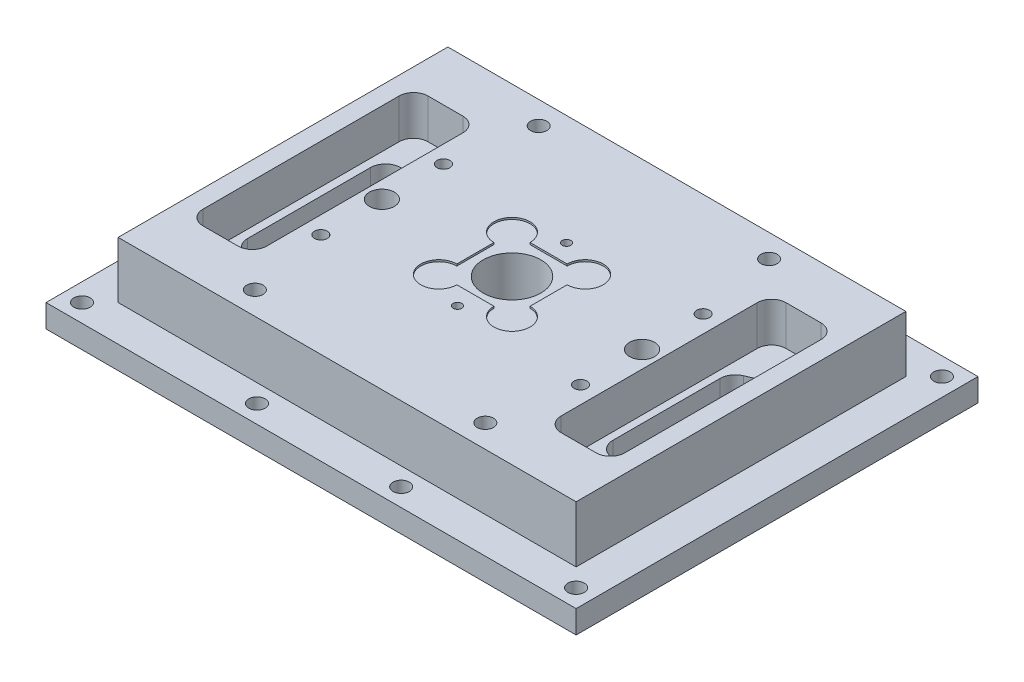
from build123d import *

# Parameters (mm, degrees)
MAIN_SKETCH_W                           = 73.5
MAIN_SKETCH_H                           = 55.72
MAIN_SKETCH_W_2                         = 63.5
MAIN_SKETCH_H_2                         = 45.72
LIP_DEPTH                               = 3.175
MOUNTING_BASE_OUTLINE_W                 = 63.5
MOUNTING_BASE_OUTLINE_H                 = 45.72
MOUNTING_BASE_OUTLINE_R                 = 1.7272
MOUNTING_BASE_OUTLINE_R_2               = 4
MOUNTING_BASE_DEPTH                     = 11
HEATER_CART_4_40_TAPS_D                 = 2.2606
HEATER_CART_4_40_TAPS_DEPTH             = 7.595
HEATER_CART_4_40_TAPS_TIP               = 0.679152758
MAIN_SKETCH_12_W                        = 8.85
MAIN_SKETCH_12_H                        = 31.2
BOTTOM_SQUARE_CUTOUT_DEPTH              = 2
SQUARE_MICRO_D_CUTOUT_START             = 5.5
SQUARE_MICRO_D_CUTOUT_OUTLINE_W         = 8.85
SQUARE_MICRO_D_CUTOUT_OUTLINE_H         = 31.2
SQUARE_MICRO_D_CUTOUT_DEPTH             = 5.5
ROUND_MICRO_D_CUTOUT_REACH              = 94.887
MAIN_SKETCH_7_R                         = 0.285
INTERNAL_CORNER_CUTOUTS_FILLET_R        = 2
CHIP_CLAMP_0_80_TAPS_AT_2_COUNT         = 2
CHIP_CLAMP_0_80_TAPS_AT_2_PITCH         = 15.1232
CHIP_CLAMP_0_80_TAPS_AT_3_COUNT         = 2
CHIP_CLAMP_0_80_TAPS_AT_3_PITCH         = 15.1232
CHIP_POCKET_START                       = 10.75
MAIN_SKETCH_6_R                         = 2.5
MAIN_SKETCH_6_W                         = 10.15
MAIN_SKETCH_6_H                         = 10.15
CHIP_POCKET_DEPTH                       = 0.25
F_2_56_CLOSE_CLEAR_43_0_089_D           = 2.2606
F_2_56_CLOSE_CLEAR_43_0_089_ON_FACE_2_D = 2.2606
F_2_56_CLOSE_CLEAR_43_0_089_ON_FACE_3_D = 2.2606
PCB_2_56_TAPS_D                         = 1.778
PCB_2_56_TAPS_DEPTH                     = 5.734
PCB_2_56_TAPS_TIP                       = 0.53416509
BOTTOM_COVER_2_56_TAPS_D                = 1.778
BOTTOM_COVER_2_56_TAPS_DEPTH            = 5.734
BOTTOM_COVER_2_56_TAPS_TIP              = 0.53416509


# Read off the part's stored shape, not the designer's step: Mounting_Base, Square_Micro_D_Cutout
with BuildPart() as part:
    # Main_Sketch → Lip (new body)
    with BuildSketch(Plane(origin=(0, 0, 0), x_dir=(1, 0, 0), z_dir=(0, 1, 0))):
        with Locations((36.75, -27.86)):
            Rectangle(MAIN_SKETCH_W, MAIN_SKETCH_H)
        with Locations((36.75, -27.86)):
            Rectangle(MAIN_SKETCH_W_2, MAIN_SKETCH_H_2, mode=Mode.SUBTRACT)
    extrude(amount=LIP_DEPTH)

    # Mounting_Base outline → Mounting_Base (add)
    with BuildSketch(Plane(origin=(0, 0, 0), x_dir=(1, 0, 0), z_dir=(0, 1, 0))):
        with Locations((36.75, -27.86)):
            Rectangle(MOUNTING_BASE_OUTLINE_W, MOUNTING_BASE_OUTLINE_H)
        with Locations((18.715, -27.86)):
            Circle(MOUNTING_BASE_OUTLINE_R, mode=Mode.SUBTRACT)
        with Locations((36.75, -27.86)):
            Circle(MOUNTING_BASE_OUTLINE_R_2, mode=Mode.SUBTRACT)
        with Locations((54.785, -27.86)):
            Circle(MOUNTING_BASE_OUTLINE_R, mode=Mode.SUBTRACT)
    extrude(amount=MOUNTING_BASE_DEPTH)

    # Heater_Cart_#4-40_Taps
    with Locations(Plane(origin=(20.775, 11, 8.185), x_dir=(0, 0, 1), z_dir=(0, 1, 0))):
        with Locations((0, 0), (0, 31.95), (39.35, 31.95), (39.35, 0)):
            Hole(HEATER_CART_4_40_TAPS_D / 2, depth=HEATER_CART_4_40_TAPS_DEPTH)
            with Locations((0, 0, -(HEATER_CART_4_40_TAPS_DEPTH + HEATER_CART_4_40_TAPS_TIP / 2))):  # 118° drill point
                Cone(0, HEATER_CART_4_40_TAPS_D / 2, HEATER_CART_4_40_TAPS_TIP, mode=Mode.SUBTRACT)

    # Main_Sketch<12> → Bottom_square_cutout (cut)
    with BuildSketch(Plane(origin=(0, 0, 0), x_dir=(1, 0, 0), z_dir=(0, 1, 0))):
        with Locations((11.925, -27.86)):
            Rectangle(MAIN_SKETCH_12_W, MAIN_SKETCH_12_H)
        with BuildLine():
            ThreePointArc((11.521574965, -38.306222286), (10.496212222, -38.461578951), (9.521946869, -38.106175702))
            ThreePointArc((9.521946869, -38.106175702), (8.851632057, -37.354424217), (8.609546604, -36.37675))
            Line((8.609546604, -36.37675), (8.609546604, -19.34325))
            ThreePointArc((8.609546604, -19.34325), (8.851632057, -18.365575783), (9.521946869, -17.613824298))
            ThreePointArc((9.521946869, -17.613824298), (10.496212222, -17.258421049), (11.521574965, -17.413777714))
            Line((11.521574965, -17.413777714), (14.054010046, -18.48581902))
            ThreePointArc((14.054010046, -18.48581902), (14.983840891, -19.258001292), (15.3324534, -20.415291306))
            Line((15.3324534, -20.415291306), (15.3324534, -35.304708694))
            ThreePointArc((15.3324534, -35.304708694), (14.983840891, -36.461998708), (14.054010046, -37.23418098))
            Line((14.054010046, -37.23418098), (11.521574965, -38.306222286))
        make_face(mode=Mode.SUBTRACT)
    bottom_square_cutout = extrude(amount=BOTTOM_SQUARE_CUTOUT_DEPTH, mode=Mode.SUBTRACT)

    # Square_Micro_D_Cutout outline → Square_Micro_D_Cutout (cut)
    with BuildSketch(Plane(origin=(0, 0, 0), x_dir=(1, 0, 0), z_dir=(0, 1, 0)).offset(SQUARE_MICRO_D_CUTOUT_START)):
        with Locations((11.925, -27.86)):
            Rectangle(SQUARE_MICRO_D_CUTOUT_OUTLINE_W, SQUARE_MICRO_D_CUTOUT_OUTLINE_H)
        with BuildLine():
            ThreePointArc((11.521574965, -38.306222286), (9.547492447, -38.123373348), (8.609546604, -36.37675))
            Line((8.609546604, -36.37675), (8.609546604, -19.34325))
            ThreePointArc((8.609546604, -19.34325), (9.547492447, -17.596626652), (11.521574965, -17.413777714))
            Line((11.521574965, -17.413777714), (14.054010046, -18.48581902))
            ThreePointArc((14.054010046, -18.48581902), (14.983840891, -19.258001291), (15.3324534, -20.415291306))
            Line((15.3324534, -20.415291306), (15.3324534, -35.304708694))
            ThreePointArc((15.3324534, -35.304708694), (14.983840891, -36.461998709), (14.054010046, -37.23418098))
            Line((14.054010046, -37.23418098), (11.521574965, -38.306222286))
        make_face(mode=Mode.SUBTRACT)
    square_micro_d_cutout = extrude(amount=SQUARE_MICRO_D_CUTOUT_DEPTH, mode=Mode.SUBTRACT)

    # Main_Sketch<7> → Round_Micro_D_Cutout (cut, up to next)
    with BuildSketch(Plane(origin=(0, 0, 0), x_dir=(1, 0, 0), z_dir=(0, 1, 0)), mode=Mode.PRIVATE) as round_micro_d_cutout_sk1:
        with BuildLine():
            ThreePointArc((9.521946869, -38.106175702), (8.851632057, -37.354424217), (8.609546604, -36.37675))
            Line((8.609546604, -36.37675), (8.609546604, -19.34325))
            ThreePointArc((8.609546604, -19.34325), (8.851632057, -18.365575783), (9.521946869, -17.613824298))
            ThreePointArc((9.521946869, -17.613824298), (10.496212222, -17.258421049), (11.521574965, -17.413777714))
            Line((11.521574965, -17.413777714), (14.054010046, -18.48581902))
            ThreePointArc((14.054010046, -18.48581902), (14.983840891, -19.258001292), (15.3324534, -20.415291306))
            Line((15.3324534, -20.415291306), (15.3324534, -35.304708694))
            ThreePointArc((15.3324534, -35.304708694), (14.983840891, -36.461998708), (14.054010046, -37.23418098))
            Line((14.054010046, -37.23418098), (11.521574965, -38.306222286))
            ThreePointArc((11.521574965, -38.306222286), (10.496212222, -38.461578951), (9.521946869, -38.106175702))
        make_face()
        with Locations((11.399546604, -27.86)):
            Circle(MAIN_SKETCH_7_R, mode=Mode.SUBTRACT)
    round_micro_d_cutout_tool1 = extrude(round_micro_d_cutout_sk1.sketch, amount=ROUND_MICRO_D_CUTOUT_REACH, mode=Mode.PRIVATE) & part.part
    # Main_Sketch<7> → Round_Micro_D_Cutout (cut, up to next)
    with BuildSketch(Plane(origin=(0, 0, 0), x_dir=(1, 0, 0), z_dir=(0, 1, 0)), mode=Mode.PRIVATE) as round_micro_d_cutout_sk2:
        with Locations((11.399546604, -27.86)):
            Circle(MAIN_SKETCH_7_R)
    round_micro_d_cutout_tool2 = extrude(round_micro_d_cutout_sk2.sketch, amount=ROUND_MICRO_D_CUTOUT_REACH, mode=Mode.PRIVATE) & part.part
    round_micro_d_cutout_1 = round_micro_d_cutout_tool1.solids().sort_by_distance((11.886838, 0, 27.86))[0]
    add(round_micro_d_cutout_1, mode=Mode.SUBTRACT)
    round_micro_d_cutout_2 = round_micro_d_cutout_tool2.solids().sort_by_distance((11.399547, 0, 27.86))[0]
    add(round_micro_d_cutout_2, mode=Mode.SUBTRACT)
    round_micro_d_cutout = round_micro_d_cutout_1 + round_micro_d_cutout_2  # Round_Micro_D_Cutout as one shape, for the pattern or mirror that repeats it

    # MicroD_Mirror: Bottom_square_cutout, Square_Micro_D_Cutout, Round_Micro_D_Cutout across plane
    add(bottom_square_cutout.mirror(Plane.ZY.offset(-36.75)), mode=Mode.SUBTRACT)
    add(square_micro_d_cutout.mirror(Plane.ZY.offset(-36.75)), mode=Mode.SUBTRACT)
    add(round_micro_d_cutout.mirror(Plane.ZY.offset(-36.75)), mode=Mode.SUBTRACT)

    # Internal_Corner_cutouts_fillet
    internal_corner_cutouts_fillet_edges = [part.edges().sort_by_distance(p)[0] for p in [
        (16.35, 8.25, 43.46),
        (7.5, 8.25, 43.46),
        (7.5, 8.25, 12.26),
        (16.35, 8.25, 12.26),
        (57.15, 1, 12.26),
        (57.15, 1, 43.46),
        (66, 1, 43.46),
        (66, 1, 12.26),
        (66, 8.25, 12.26),
        (66, 8.25, 43.46),
        (57.15, 8.25, 43.46),
        (57.15, 8.25, 12.26),
        (16.35, 1, 43.46),
        (16.35, 1, 12.26),
        (7.5, 1, 12.26),
        (7.5, 1, 43.46),
    ]]
    fillet(internal_corner_cutouts_fillet_edges, radius=INTERNAL_CORNER_CUTOUTS_FILLET_R)

    # Sketch3 → Chip_Clamp_#0-80 Taps (revolve, cut)
    with BuildSketch(Plane(origin=(36.75, 11, 35.4216), x_dir=(0, 0, 1), z_dir=(1, 0, 0))):
        Polygon((0, 0), (0, 4.358890611), (0.59563, 4.001), (0.59563, 0), align=None)
    chip_clamp_0_80_taps = revolve(axis=Axis((36.75, 17.35, 35.4216), (0, -1, 0)), mode=Mode.SUBTRACT)

    # Chip_Clamp_#0-80 Taps at 2: Chip_Clamp_#0-80 Taps ×2
    with Locations(*[(0, 0, -i * CHIP_CLAMP_0_80_TAPS_AT_2_PITCH) for i in range(1, CHIP_CLAMP_0_80_TAPS_AT_2_COUNT)]):
        add(chip_clamp_0_80_taps, mode=Mode.SUBTRACT)

    # Chip_Clamp_#0-80 Taps at 3: Chip_Clamp_#0-80 Taps ×2
    with Locations(*[(0, 0, -i * CHIP_CLAMP_0_80_TAPS_AT_3_PITCH) for i in range(1, CHIP_CLAMP_0_80_TAPS_AT_3_COUNT)]):
        add(chip_clamp_0_80_taps, mode=Mode.SUBTRACT)

    # Main_Sketch<6> → Chip_Pocket (cut)
    with BuildSketch(Plane(origin=(0, 0, 0), x_dir=(1, 0, 0), z_dir=(0, 1, 0)).offset(CHIP_POCKET_START)):
        with BuildLine():
            Line((31.675, -25.285), (31.675, -22.785))
            Line((31.675, -22.785), (34.175, -22.785))
            ThreePointArc((34.175, -22.785), (29.907233047, -21.017233047), (31.675, -25.285))
        make_face()
        with BuildLine():
            Line((34.175, -22.785), (31.675, -22.785))
            Line((31.675, -22.785), (31.675, -25.285))
            ThreePointArc((31.675, -25.285), (33.442766953, -24.552766953), (34.175, -22.785))
        make_face()
        with BuildLine():
            ThreePointArc((44.325, -22.785), (41.825, -20.285), (39.325, -22.785))
            Line((39.325, -22.785), (41.825, -22.785))
            Line((41.825, -22.785), (41.825, -25.285))
            ThreePointArc((41.825, -25.285), (43.592766953, -24.552766953), (44.325, -22.785))
        make_face()
        with BuildLine():
            Line((41.825, -22.785), (39.325, -22.785))
            ThreePointArc((39.325, -22.785), (40.057233047, -24.552766953), (41.825, -25.285))
            Line((41.825, -25.285), (41.825, -22.785))
        make_face()
        with BuildLine():
            ThreePointArc((34.175, -32.935), (33.442766953, -31.167233047), (31.675, -30.435))
            Line((31.675, -30.435), (31.675, -32.935))
            Line((31.675, -32.935), (34.175, -32.935))
        make_face()
        with BuildLine():
            Line((31.675, -32.935), (31.675, -30.435))
            ThreePointArc((31.675, -30.435), (29.907233047, -34.702766953), (34.175, -32.935))
            Line((34.175, -32.935), (31.675, -32.935))
        make_face()
        with BuildLine():
            ThreePointArc((44.325, -32.935), (43.592766953, -31.167233047), (41.825, -30.435))
            Line((41.825, -30.435), (41.825, -32.935))
            Line((41.825, -32.935), (39.325, -32.935))
            ThreePointArc((39.325, -32.935), (41.825, -35.435), (44.325, -32.935))
        make_face()
        with BuildLine():
            Line((41.825, -32.935), (41.825, -30.435))
            ThreePointArc((41.825, -30.435), (40.057233047, -31.167233047), (39.325, -32.935))
            Line((39.325, -32.935), (41.825, -32.935))
        make_face()
        with Locations((41.825, -32.935)):
            Circle(MAIN_SKETCH_6_R)
        with Locations((41.825, -22.785)):
            Circle(MAIN_SKETCH_6_R)
        with Locations((31.675, -22.785)):
            Circle(MAIN_SKETCH_6_R)
        with Locations((31.675, -32.935)):
            Circle(MAIN_SKETCH_6_R)
        with Locations((36.75, -27.86)):
            Rectangle(MAIN_SKETCH_6_W, MAIN_SKETCH_6_H)
    extrude(amount=CHIP_POCKET_DEPTH, mode=Mode.SUBTRACT)

    # 2-56_Close_Clear#43 (0.089) (through all)
    with Locations(Plane(origin=(2.5, 11, 2.5), x_dir=(0, 0, 1), z_dir=(0, 1, 0))):
        with Locations((0, 0)):
            Hole(F_2_56_CLOSE_CLEAR_43_0_089_D / 2)

    # 2-56_Close_Clear#43 (0.089) on face 2 (through all)
    with Locations(Plane(origin=(26.75, 0, 53.22), x_dir=(0, 0, -1), z_dir=(0, -1, 0))):
        with Locations((0, 0), (50.72, 44.25), (50.72, 20), (0, 44.25), (0, 20), (0, -24.25), (50.72, 0)):
            Hole(F_2_56_CLOSE_CLEAR_43_0_089_ON_FACE_2_D / 2)

    # 2-56_Close_Clear#43 (0.089) on face 3 (through all)
    with Locations(Plane(origin=(26.75, 3.175, 53.22), x_dir=(0, 0, 1), z_dir=(0, 1, 0))):
        with Locations((0, 0), (-50.72, 44.25), (-50.72, 20), (0, 44.25), (0, 20), (0, -24.25), (-50.72, 0)):
            Hole(F_2_56_CLOSE_CLEAR_43_0_089_ON_FACE_3_D / 2)

    # PCB #2-56 Taps
    with Locations(Plane(origin=(18.75, 11, 19.36), x_dir=(0, 0, 1), z_dir=(0, 1, 0))):
        with Locations((0, 0), (17, 0), (0, 36), (17, 36)):
            Hole(PCB_2_56_TAPS_D / 2, depth=PCB_2_56_TAPS_DEPTH)
            with Locations((0, 0, -(PCB_2_56_TAPS_DEPTH + PCB_2_56_TAPS_TIP / 2))):  # 118° drill point
                Cone(0, PCB_2_56_TAPS_D / 2, PCB_2_56_TAPS_TIP, mode=Mode.SUBTRACT)

    # Bottom_Cover#2-56 Taps
    with Locations(Plane(origin=(41.825, 0, 22.785), x_dir=(0, 0, -1), z_dir=(0, -1, 0))):
        with Locations((0, 0), (0, -10.15), (-10.15, -10.15), (-10.15, 0), (1.275, 12.96), (-11.425, 12.96), (-11.425, -23.11), (1.275, -23.11)):
            Hole(BOTTOM_COVER_2_56_TAPS_D / 2, depth=BOTTOM_COVER_2_56_TAPS_DEPTH)
            with Locations((0, 0, -(BOTTOM_COVER_2_56_TAPS_DEPTH + BOTTOM_COVER_2_56_TAPS_TIP / 2))):  # 118° drill point
                Cone(0, BOTTOM_COVER_2_56_TAPS_D / 2, BOTTOM_COVER_2_56_TAPS_TIP, mode=Mode.SUBTRACT)


solid = part.part
